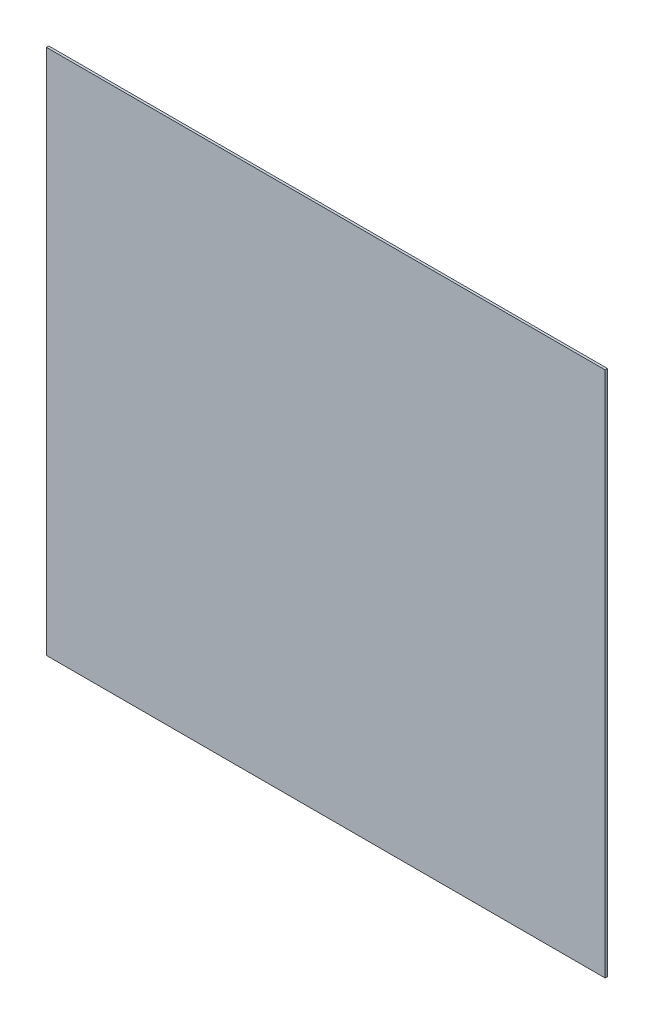
from build123d import *

# Parameters (mm, degrees)
SKETCH2_W           = 350
SKETCH2_H           = 330
BOSS_EXTRUDE2_DEPTH = 1.5


with BuildPart() as part:
    # Sketch2 → Boss-Extrude2 (new body)
    with BuildSketch(Plane.XY):
        Rectangle(SKETCH2_W, SKETCH2_H)
    extrude(amount=BOSS_EXTRUDE2_DEPTH)


solid = part.part
